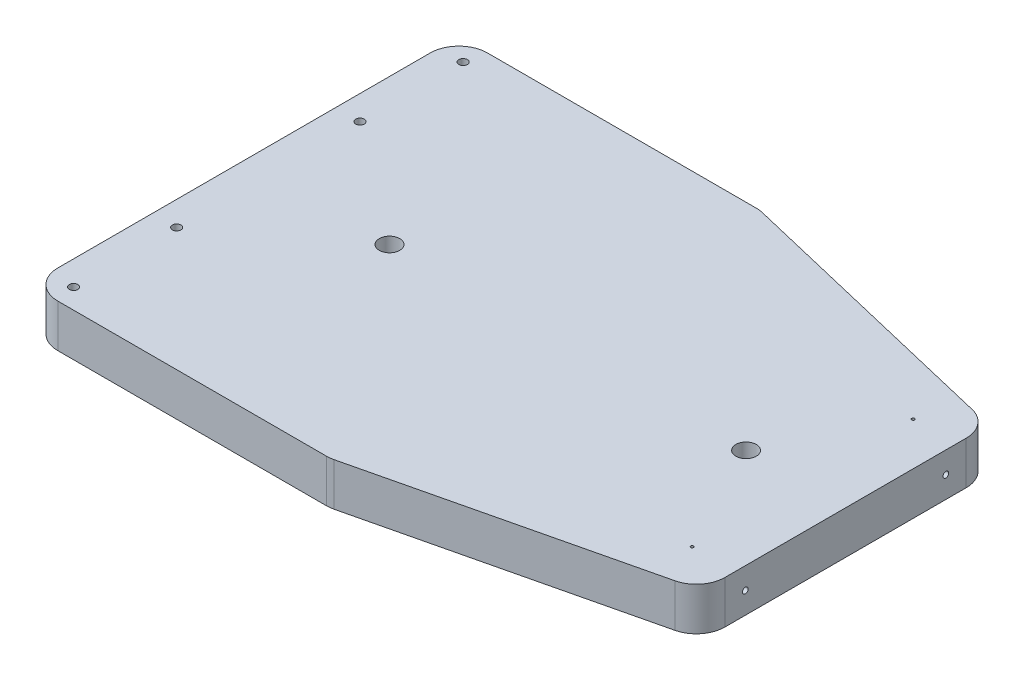
from build123d import *

# Parameters (mm, degrees)
ESBO_O1_R                = 3.571875
ESBO_O1_R_2              = 3.57
ESBO_O1_R_3              = 1.5
ESBO_O1_R_4              = 0.5
RESSALTO_EXTRUS_O1_DEPTH = 15
ESBO_O2_R                = 1
CORTE_EXTRUS_O1_DEPTH    = 10
FILETE1_R                = 10


with BuildPart() as part:
    # Esboço1 → Ressalto-extrusão1 (new body)
    with BuildSketch(Plane(origin=(0, 0, 0), x_dir=(1, 0, 0), z_dir=(0, 1, 0))):
        Polygon((210, 50), (105, 75), (0, 75), (0, -75), (105, -75), (210, -50), align=None)
        with Locations((50.8, 0)):
            Circle(ESBO_O1_R, mode=Mode.SUBTRACT)
        with Locations((175.26, 0)):
            Circle(ESBO_O1_R_2, mode=Mode.SUBTRACT)
        with Locations((8.5, -68)):
            Circle(ESBO_O1_R_3, mode=Mode.SUBTRACT)
        with Locations((8.5, -32)):
            Circle(ESBO_O1_R_3, mode=Mode.SUBTRACT)
        with Locations((8.5, 32)):
            Circle(ESBO_O1_R_3, mode=Mode.SUBTRACT)
        with Locations((8.5, 68)):
            Circle(ESBO_O1_R_3, mode=Mode.SUBTRACT)
        with Locations((195, -38.571428571)):
            Circle(ESBO_O1_R_4, mode=Mode.SUBTRACT)
        with Locations((195, 38.571428571)):
            Circle(ESBO_O1_R_4, mode=Mode.SUBTRACT)
    extrude(amount=RESSALTO_EXTRUS_O1_DEPTH)

    # Esboço2 → Corte-extrusão1 (cut)
    with BuildSketch(Plane(origin=(210, 0, 0), x_dir=(0, 0, -1), z_dir=(1, 0, 0))):
        with Locations((-35, 7.5)):
            Circle(ESBO_O2_R)
        with Locations((35, 7.5)):
            Circle(ESBO_O2_R)
    extrude(amount=-CORTE_EXTRUS_O1_DEPTH, mode=Mode.SUBTRACT)

    # Filete1
    filete1_edges = [part.edges().sort_by_distance(p)[0] for p in [
        (0, 7.5, 75),
        (105, 7.5, 75),
        (210, 7.5, 50),
        (210, 7.5, -50),
        (0, 7.5, -75),
        (105, 7.5, -75),
    ]]
    fillet(filete1_edges, radius=FILETE1_R)


solid = part.part
